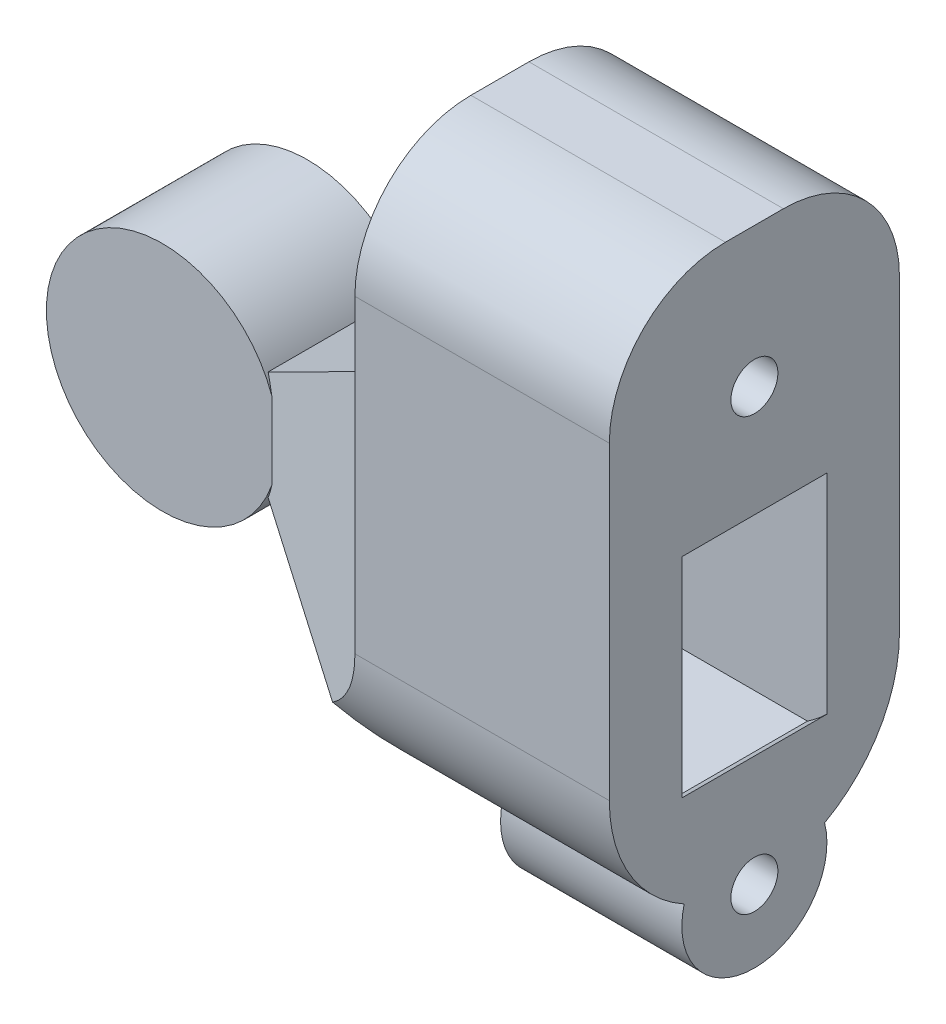
from build123d import *

# Parameters (mm, degrees)
BOSS_EXTRUDE1_DEPTH   = 6.35
BOSS_EXTRUDE2_START   = 3.175
BOSS_EXTRUDE2_DEPTH   = 12.7
CUT_EXTRUDE1_START    = -3.175
CUT_EXTRUDE1_DEPTH    = 6.35
F_1_CLEARANCE_HOLE1_D = 2.0574
FILLET4_START         = 4.487320853
FILLET4_DEPTH         = 18.252718486
FILLET5_R             = 5.08
CHAMFER3_SIZE         = 7.112
CHAMFER3_SIZE_2       = 3.316380065
BOSS_EXTRUDE3_START   = -7.9375
BOSS_EXTRUDE3_DEPTH   = 7.9375
F_1_CLEARANCE_HOLE2_D = 2.0574
SKETCH14_R            = 3.175
CUT_EXTRUDE2_DEPTH    = 27.974866065


with BuildPart() as part:
    # Sketch1 → Boss-Extrude1 (new body)
    with BuildSketch(Plane.XY):
        with BuildLine():
            Line((4.487320853, -2.38125), (4.487320853, 2.38125))
            ThreePointArc((4.487320853, 2.38125), (-5.08, 0), (4.487320853, -2.38125))
        make_face()
    extrude(amount=BOSS_EXTRUDE1_DEPTH)

    # Sketch2 → Boss-Extrude2 (add)
    with BuildSketch(Plane.XY.offset(6.35).offset(BOSS_EXTRUDE2_START)):
        Polygon((4.487320853, 2.38125), (4.487320853, -2.38125), (11.60035513, -7.606064703), (14.093661168, -9.4375), (22.740039339, -9.4375), (22.740039339, -7.631102389), (22.740039339, 7.631102389), (22.740039339, 15.543564703), (11.60035513, 15.543564703), (11.60035513, 7.606064703), align=None)
    extrude(amount=-BOSS_EXTRUDE2_DEPTH)

    # Sketch10 → Cut-Extrude1 (cut)
    with BuildSketch(Plane(origin=(0, 0, -3.175), x_dir=(-1, 0, 0), z_dir=(0, 0, -1)).offset(CUT_EXTRUDE1_START)):
        with BuildLine():
            Line((-22.740039339, -4.572), (-22.740039339, 4.572))
            ThreePointArc((-22.740039339, 4.572), (-22.329545252, 4.934830916), (-21.88930404, 5.260928055))
            Line((-21.88930404, 5.260928055), (-14.77730404, 5.260928055))
            ThreePointArc((-14.77730404, 5.260928055), (-13.687099855, 4.328427737), (-12.834042726, 3.175))
            Line((-12.834042726, 3.175), (-12.834042726, -3.175))
            ThreePointArc((-12.834042726, -3.175), (-13.687099855, -4.328427737), (-14.77730404, -5.260928055))
            Line((-14.77730404, -5.260928055), (-21.88930404, -5.260928055))
            ThreePointArc((-21.88930404, -5.260928055), (-22.329545252, -4.934830916), (-22.740039339, -4.572))
        make_face()
    extrude(amount=-CUT_EXTRUDE1_DEPTH, mode=Mode.SUBTRACT)

    # #1 Clearance Hole1 (through all)
    with Locations(Plane(origin=(22.740039339, 0, 0), x_dir=(0, 0, -1), z_dir=(1, 0, 0))):
        with Locations((-3.175, 9.4375)):
            Hole(F_1_CLEARANCE_HOLE1_D / 2)

    # Fillet4: read off the stored shape, not the designer's step
    # Fillet4 outline → Fillet4 (cut)
    with BuildSketch(Plane.YZ.offset(FILLET4_START)):
        with BuildLine():
            Line((-9.4375, -3.175), (-3.0875, -3.175))
            ThreePointArc((-3.0875, -3.175), (-7.577628061, -1.315128061), (-9.4375, 3.175))
            Line((-9.4375, 3.175), (-9.4375, -3.175))
        make_face()
        with BuildLine():
            Line((-9.4375, 9.525), (-9.4375, 3.175))
            ThreePointArc((-9.4375, 3.175), (-7.577628061, 7.665128061), (-3.0875, 9.525))
            Line((-3.0875, 9.525), (-9.4375, 9.525))
        make_face()
    extrude(amount=FILLET4_DEPTH, mode=Mode.SUBTRACT)

    # Fillet5
    fillet5_edges = [part.edges().sort_by_distance(p)[0] for p in [
        (17.170197235, 15.543564703, -3.175),
        (17.170197235, 15.543564703, 9.525),
    ]]
    fillet(fillet5_edges, radius=FILLET5_R)

    # Chamfer3
    # the kernel refuses this chamfer: 7.112, 3.316380065 mm, written as the material it takes off along each edge
    with BuildSketch(Plane(origin=(4.487320853, 20.808267553, -3.175), x_dir=(1, 0, 0), z_dir=(0, -1, 0))) as chamfer3_piece_1_section:
        Polygon((CHAMFER3_SIZE, 0), (0, CHAMFER3_SIZE_2), (0, 0), align=None)
    chamfer3_piece_1 = extrude(amount=41.616535106, mode=Mode.PRIVATE)
    chamfer3_piece_1 = chamfer3_piece_1 - Plane(origin=(0, 0, -3.175), x_dir=(0.8833308765689106, 0.46875000000000017, 0), z_dir=(0, 0, -1)) * Cylinder(5.08, 112, mode=Mode.PRIVATE)
    add(chamfer3_piece_1, mode=Mode.SUBTRACT)
    with BuildSketch(Plane(origin=(4.487320853, 20.808267553, -3.175), x_dir=(1, 0, 0), z_dir=(0, -1, 0))) as chamfer3_piece_2_section:
        Polygon((CHAMFER3_SIZE, 0), (0, CHAMFER3_SIZE_2), (0, 0), align=None)
    chamfer3_piece_2 = extrude(amount=41.616535106, mode=Mode.PRIVATE)
    chamfer3_piece_2 = split(chamfer3_piece_2, bisect_by=Plane(origin=(4.487320853, 20.808267553, 0), z_dir=(0, 0, -1)), keep=Keep.TOP, mode=Mode.PRIVATE)
    add(chamfer3_piece_2, mode=Mode.SUBTRACT)
    with BuildSketch(Plane(origin=(4.487320853, 20.808267553, 9.525), x_dir=(1, 0, 0), z_dir=(0, -1, 0))) as chamfer3_piece_3_section:
        Polygon((CHAMFER3_SIZE, 0), (0, -CHAMFER3_SIZE_2), (0, 0), align=None)
    chamfer3_piece_3 = extrude(amount=41.616535106, mode=Mode.PRIVATE)
    chamfer3_piece_3 = chamfer3_piece_3 - Plane(origin=(0, 0, 9.525), x_dir=(0.8833308765689106, 0.46875000000000017, 0), z_dir=(0, 0, -1)) * Cylinder(5.08, 112, mode=Mode.PRIVATE)
    add(chamfer3_piece_3, mode=Mode.SUBTRACT)
    with BuildSketch(Plane(origin=(4.487320853, 20.808267553, 9.525), x_dir=(1, 0, 0), z_dir=(0, -1, 0))) as chamfer3_piece_4_section:
        Polygon((CHAMFER3_SIZE, 0), (0, -CHAMFER3_SIZE_2), (0, 0), align=None)
    chamfer3_piece_4 = extrude(amount=41.616535106, mode=Mode.PRIVATE)
    chamfer3_piece_4 = split(chamfer3_piece_4, bisect_by=Plane(origin=(4.487320853, 20.808267553, 6.35), z_dir=(0, 0, 1)), keep=Keep.TOP, mode=Mode.PRIVATE)
    add(chamfer3_piece_4, mode=Mode.SUBTRACT)

    # Sketch11 → Boss-Extrude3 (add)
    with BuildSketch(Plane(origin=(22.740039339, 0, 0), x_dir=(0, 0, -1), z_dir=(1, 0, 0)).offset(BOSS_EXTRUDE3_START)):
        with BuildLine():
            ThreePointArc((-6.249180531, -8.64375), (-3.175, -12.6125), (-0.100819469, -8.64375))
            ThreePointArc((-0.100819469, -8.64375), (-3.175, -9.4375), (-6.249180531, -8.64375))
        make_face()
    extrude(amount=BOSS_EXTRUDE3_DEPTH)

    # #1 Clearance Hole2 (through all)
    with Locations(Plane(origin=(22.740039339, 0, 0), x_dir=(0, 0, -1), z_dir=(1, 0, 0))):
        with Locations((-3.175, -9.4375)):
            Hole(F_1_CLEARANCE_HOLE2_D / 2)

    # Sketch14 → Cut-Extrude2 (cut, through all)
    with BuildSketch(Plane.ZY.offset(-14.802539339)):
        with Locations((3.175, -9.4375)):
            Circle(SKETCH14_R)
    extrude(amount=CUT_EXTRUDE2_DEPTH, mode=Mode.SUBTRACT)


solid = part.part
